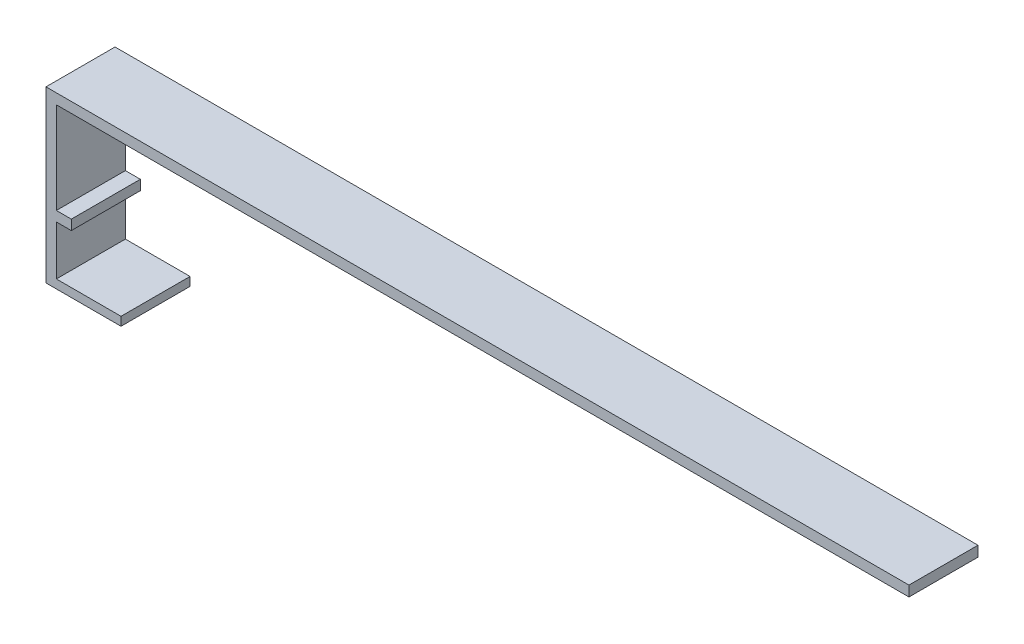
from build123d import *

# Parameters (mm, degrees)
SKETCH1_W           = 250
SKETCH1_H           = 20
BOSS_EXTRUDE1_DEPTH = 3
BOSS_EXTRUDE3_DEPTH = 20
SKETCH7_W           = 6.333920814
SKETCH7_H           = 2.876640877
BOSS_EXTRUDE4_DEPTH = 20
SKETCH8_W           = 21.731183485
SKETCH8_H           = 2.508317786
BOSS_EXTRUDE6_DEPTH = 20
SKETCH10_W          = 21.121334698
SKETCH10_H          = 3.583975783
CUT_EXTRUDE3_DEPTH  = 2


with BuildPart() as part:
    # Sketch1 → Boss-Extrude1 (new body)
    with BuildSketch(Plane(origin=(0, 0, 0), x_dir=(1, 0, 0), z_dir=(0, 1, 0))):
        with Locations((125, 10)):
            Rectangle(SKETCH1_W, SKETCH1_H)
    extrude(amount=BOSS_EXTRUDE1_DEPTH)

    # Sketch4 → Boss-Extrude3 (add)
    with BuildSketch(Plane(origin=(0, 0, -20), x_dir=(-1, 0, 0), z_dir=(0, 0, -1))):
        Polygon((0, -45.538212503), (0, 0), (-3, 0), (-3, -24), (-3, -26.692100843), (-3, -45.538212503), align=None)
    extrude(amount=-BOSS_EXTRUDE3_DEPTH)

    # Sketch7 → Boss-Extrude4 (add)
    with BuildSketch(Plane.XY):
        with Locations((6.166960407, -27.958320439)):
            Rectangle(SKETCH7_W, SKETCH7_H)
    extrude(amount=-BOSS_EXTRUDE4_DEPTH)

    # Sketch8 → Boss-Extrude6 (add)
    with BuildSketch(Plane(origin=(0, 0, -20), x_dir=(-1, 0, 0), z_dir=(0, 0, -1))):
        with Locations((-10.865591743, -44.954158893)):
            Rectangle(SKETCH8_W, SKETCH8_H)
    extrude(amount=-BOSS_EXTRUDE6_DEPTH)

    # Sketch10 → Cut-Extrude3 (cut)
    with BuildSketch(Plane(origin=(9.333920814, 0, 0), x_dir=(0, 0, -1), z_dir=(1, 0, 0))):
        with Locations((10.560667349, -28.311987892)):
            Rectangle(SKETCH10_W, SKETCH10_H)
    extrude(amount=-CUT_EXTRUDE3_DEPTH, mode=Mode.SUBTRACT)


solid = part.part
